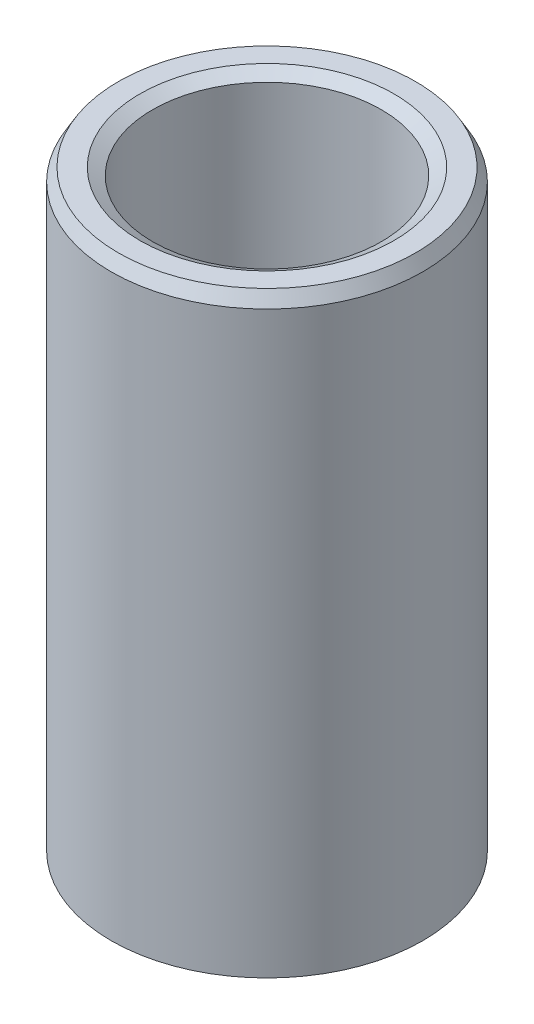
from build123d import *
from OCP.BRepFilletAPI import BRepFilletAPI_MakeChamfer

# Parameters (mm, degrees)
SKETCH1_R           = 25
BOSS_EXTRUDE1_DEPTH = 96.127159377
SKETCH2_R           = 18.350661552
CUT_EXTRUDE1_DEPTH  = 103.422803954
CHAMFER1_SIZE       = 2.033718851
CHAMFER1_SIZE2      = 1.174168126


with BuildPart() as part:
    # Sketch1 → Boss-Extrude1 (new body)
    with BuildSketch(Plane(origin=(0, 0, 0), x_dir=(1, 0, 0), z_dir=(0, 1, 0))):
        Circle(SKETCH1_R)
    extrude(amount=BOSS_EXTRUDE1_DEPTH)

    # Sketch2 → Cut-Extrude1 (cut, through all)
    with BuildSketch(Plane(origin=(0, 0, 0), x_dir=(1, 0, 0), z_dir=(0, 1, 0))):
        Circle(SKETCH2_R)
    extrude(amount=CUT_EXTRUDE1_DEPTH, mode=Mode.SUBTRACT)

    # Chamfer1: one chamfer whose edges measure the first distance from different faces: ONE call of the kernel's chamfer builder (chamfer() names one face for all edges)
    chamfer1_edges_1 = [part.edges().sort_by_distance(p)[0] for p in [
        (-18.350661552, 96.127159377, 0),
    ]]
    chamfer1_side_1 = [part.faces().sort_by_distance(p)[0] for p in [
        (-24.292893219, 96.127159377, 0),
    ]]
    chamfer1_edges_2 = [part.edges().sort_by_distance(p)[0] for p in [
        (-18.350661552, 0, 0),
    ]]
    chamfer1_side_2 = [part.faces().sort_by_distance(p)[0] for p in [
        (-18.350661552, 48.063579688, 0),
    ]]
    chamfer1_edges_3 = [part.edges().sort_by_distance(p)[0] for p in [
        (-25, 0, 0),
    ]]
    chamfer1_side_3 = [part.faces().sort_by_distance(p)[0] for p in [
        (-24.292893219, 0, 0),
    ]]
    chamfer1_edges_4 = [part.edges().sort_by_distance(p)[0] for p in [
        (-25, 96.127159377, 0),
    ]]
    chamfer1_side_4 = [part.faces().sort_by_distance(p)[0] for p in [
        (-25, 48.063579688, 0),
    ]]
    chamfer1 = BRepFilletAPI_MakeChamfer(part.part.solid().wrapped)
    for e in chamfer1_edges_1:
        chamfer1.Add(CHAMFER1_SIZE, CHAMFER1_SIZE2, e.wrapped, chamfer1_side_1[0].wrapped)  # the first distance lies on this face
    for e in chamfer1_edges_2:
        chamfer1.Add(CHAMFER1_SIZE, CHAMFER1_SIZE2, e.wrapped, chamfer1_side_2[0].wrapped)  # the first distance lies on this face
    for e in chamfer1_edges_3:
        chamfer1.Add(CHAMFER1_SIZE, CHAMFER1_SIZE2, e.wrapped, chamfer1_side_3[0].wrapped)  # the first distance lies on this face
    for e in chamfer1_edges_4:
        chamfer1.Add(CHAMFER1_SIZE, CHAMFER1_SIZE2, e.wrapped, chamfer1_side_4[0].wrapped)  # the first distance lies on this face
    add(Compound.cast(chamfer1.Shape()), mode=Mode.REPLACE)


solid = part.part
